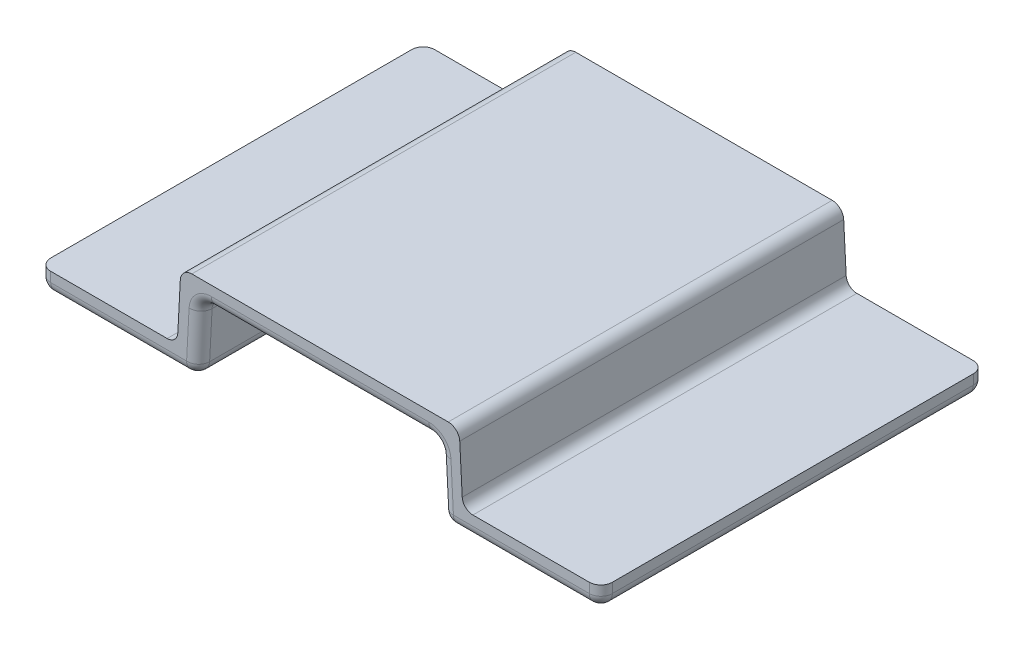
from build123d import *

# Parameters (mm, degrees)
BOSS_EXTRUDE1_DEPTH      = 225
BOSS_EXTRUDE1_DEPTH_BACK = 225
FILLET1_R                = 13.5
FILLET2_R                = 13.5
FILLET3_R                = 13.5


with BuildPart() as part:
    # Sketch1 → Boss-Extrude1 (new, two sides: drawn at the far end of the back side and taken through both)
    with BuildSketch(Plane.XY.offset(-BOSS_EXTRUDE1_DEPTH_BACK)):
        with BuildLine():
            Line((-329.1, -55), (-329.1, -80))
            Line((-329.1, -80), (-156.365701077, -80))
            ThreePointArc((-156.365701077, -80), (-147.072914305, -76.292554009), (-142.884202358, -67.206535409))
            Line((-142.884202358, -67.206535409), (-139.982869184, -11.845800547))
            ThreePointArc((-139.982869184, -11.845800547), (-136.104432196, -3.432820362), (-127.5, 0))
            Line((-127.5, 0), (127.5, 0))
            ThreePointArc((127.5, 0), (136.104432196, -3.432820362), (139.982869184, -11.845800547))
            Line((139.982869184, -11.845800547), (142.884202358, -67.206535409))
            ThreePointArc((142.884202358, -67.206535409), (147.072914305, -76.292554009), (156.365701077, -80))
            Line((156.365701077, -80), (329.1, -80))
            Line((329.1, -80), (329.1, -55))
            Line((329.1, -55), (179.140850678, -55))
            ThreePointArc((179.140850678, -55), (170.536418482, -51.567179638), (166.657981494, -43.154199453))
            Line((166.657981494, -43.154199453), (163.75664832, 12.206535409))
            ThreePointArc((163.75664832, 12.206535409), (159.567936373, 21.292554009), (150.275149601, 25))
            Line((150.275149601, 25), (-150.275149601, 25))
            ThreePointArc((-150.275149601, 25), (-159.567936373, 21.292554009), (-163.75664832, 12.206535409))
            Line((-163.75664832, 12.206535409), (-166.657981494, -43.154199453))
            ThreePointArc((-166.657981494, -43.154199453), (-170.536418482, -51.567179638), (-179.140850678, -55))
            Line((-179.140850678, -55), (-329.1, -55))
        make_face()
    extrude(amount=BOSS_EXTRUDE1_DEPTH + BOSS_EXTRUDE1_DEPTH_BACK)

    # Fillet1
    fillet1_edges = [part.edges().sort_by_distance(p)[0] for p in [
        (-242.732850539, -80, -225),
        (-147.072914305, -76.292554009, -225),
        (-141.433535771, -39.526167978, -225),
        (-136.104432196, -3.432820362, -225),
        (0, 0, -225),
        (136.104432196, -3.432820362, -225),
        (-329.1, -80, 0),
        (141.433535771, -39.526167978, -225),
        (147.072914305, -76.292554009, -225),
        (242.732850539, -80, -225),
        (-242.732850539, -80, 225),
        (-147.072914305, -76.292554009, 225),
        (-141.433535771, -39.526167978, 225),
        (-136.104432196, -3.432820362, 225),
        (0, 0, 225),
        (136.104432196, -3.432820362, 225),
        (141.433535771, -39.526167978, 225),
        (147.072914305, -76.292554009, 225),
        (242.732850539, -80, 225),
    ]]
    fillet(fillet1_edges, radius=FILLET1_R)

    # Fillet2
    fillet2_edges = [part.edges().sort_by_distance(p)[0] for p in [
        (329.1, -80, 0),
        (329.1, -60.75, 225),
        (329.1, -60.75, -225),
        (329.1, -76.045941546, 221.045941546),
        (329.1, -76.045941546, -221.045941546),
    ]]
    fillet(fillet2_edges, radius=FILLET2_R)

    # Fillet3
    # the kernel refuses this fillet: 13.5 mm, written as the material it takes off along each edge
    with BuildSketch(Plane(origin=(-315.6, -66.5, 211.5), x_dir=(0, 0, 1), z_dir=(-1, 0, 0))) as fillet3_piece_1_section:
        Polygon((0, 0), (FILLET3_R, 0), (FILLET3_R, -FILLET3_R), (0, -FILLET3_R), align=None)
    fillet3_piece_1 = extrude(amount=FILLET3_R, mode=Mode.PRIVATE)
    fillet3_piece_1 = fillet3_piece_1 - Plane(origin=(-315.6, -66.5, 211.5), x_dir=(0, 0.7071067811865475, -0.7071067811865475), z_dir=(-1, 0, 0)) * Sphere(FILLET3_R, mode=Mode.PRIVATE)
    add(fillet3_piece_1, mode=Mode.SUBTRACT)
    with BuildSketch(Plane(origin=(-315.6, -66.5, -211.5), x_dir=(-1, 0, 0), z_dir=(0, 0, -1))) as fillet3_piece_2_section:
        Polygon((0, 0), (FILLET3_R, 0), (FILLET3_R, -FILLET3_R), (0, -FILLET3_R), align=None)
    fillet3_piece_2 = extrude(amount=FILLET3_R, mode=Mode.PRIVATE)
    fillet3_piece_2 = fillet3_piece_2 - Plane(origin=(-315.6, -66.5, -211.5), x_dir=(0.7071067811865475, 0.7071067811865475, 0), z_dir=(0, 0, -1)) * Sphere(FILLET3_R, mode=Mode.PRIVATE)
    add(fillet3_piece_2, mode=Mode.SUBTRACT)
    with BuildSketch(Plane(origin=(-329.1, -21.25, 225), x_dir=(0, 0, -1), z_dir=(0, -1, 0)), Plane(origin=(-329.1, -21.25, -225), x_dir=(1, 0, 0), z_dir=(0, -1, 0))) as fillet3_piece_3:
        with BuildLine():
            CenterArc((FILLET3_R, FILLET3_R), FILLET3_R, 180, 90)
            Line((0, FILLET3_R), (0, 0))
            Line((0, 0), (FILLET3_R, 0))
        make_face()
    extrude(amount=45.25, mode=Mode.SUBTRACT)


solid = part.part
